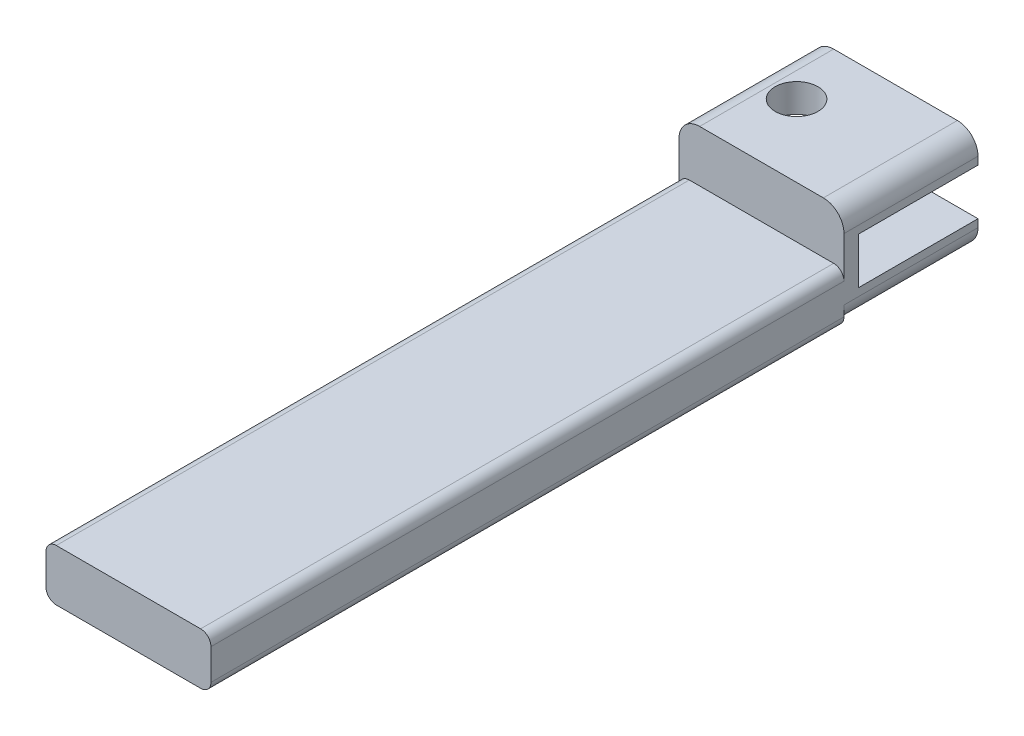
from build123d import *

# Parameters (mm, degrees)
F_01_START                                = 13
F_01_TPU_16_BY_5_GAUGE_DEPTH              = 61.40149944
F_02_CORD_END_BLOCK_DEPTH                 = 13
F_03_START                                = -0.2
S03_OPEN_TWO_EAR_PIN_CLEVIS_W             = 18
S03_OPEN_TWO_EAR_PIN_CLEVIS_H             = 4.5
F_03_OPEN_TWO_EAR_PIN_CLEVIS_DEPTH        = 11.8
F_04_START                                = -5.2
S04_SHOULDER_PIN_THROUGH_BOTH_EARS_R      = 2.08
F_04_SHOULDER_PIN_THROUGH_BOTH_EARS_DEPTH = 10.4


# Read off the part's stored shape, not the designer's step: 01 - TPU 16 by 5 gauge
with BuildPart() as part:
    # 01 - TPU 16 by 5 gauge outline → 01 - TPU 16 by 5 gauge (new body)
    with BuildSketch(Plane.XY.offset(F_01_START)):
        with BuildLine():
            ThreePointArc((-8, -4), (-7.707106781, -4.707106781), (-7, -5))
            Line((-7, -5), (7, -5))
            ThreePointArc((7, -5), (7.707106781, -4.707106781), (8, -4))
            Line((8, -4), (8, -1))
            ThreePointArc((8, -1), (7.707106781, -0.292893219), (7, 0))
            Line((7, 0), (-7, 0))
            ThreePointArc((-7, 0), (-7.707106781, -0.292893219), (-8, -1))
            Line((-8, -1), (-8, -4))
        make_face()
    extrude(amount=F_01_TPU_16_BY_5_GAUGE_DEPTH)

    # S02 - Cord end block → 02 - Cord end block (add)
    with BuildSketch(Plane.XY):
        with BuildLine():
            Line((-6, -5), (6, -5))
            ThreePointArc((6, -5), (7.414213562, -4.414213562), (8, -3))
            Line((8, -3), (8, 3))
            ThreePointArc((8, 3), (7.414213562, 4.414213562), (6, 5))
            Line((6, 5), (-6, 5))
            ThreePointArc((-6, 5), (-7.414213562, 4.414213562), (-8, 3))
            Line((-8, 3), (-8, -3))
            ThreePointArc((-8, -3), (-7.414213562, -4.414213562), (-6, -5))
        make_face()
    extrude(amount=F_02_CORD_END_BLOCK_DEPTH)

    # S03 - Open two-ear pin clevis → 03 - Open two-ear pin clevis (cut)
    with BuildSketch(Plane.XY.offset(F_03_START)):
        Rectangle(S03_OPEN_TWO_EAR_PIN_CLEVIS_W, S03_OPEN_TWO_EAR_PIN_CLEVIS_H)
    extrude(amount=F_03_OPEN_TWO_EAR_PIN_CLEVIS_DEPTH, mode=Mode.SUBTRACT)

    # S04 - Shoulder pin through both ears → 04 - Shoulder pin through both ears (cut)
    with BuildSketch(Plane(origin=(0, 0, 0), x_dir=(1, 0, 0), z_dir=(0, 1, 0)).offset(F_04_START)):
        with Locations(Location((-3.6, -6, 0), (0, 0, 90))):
            Circle(S04_SHOULDER_PIN_THROUGH_BOTH_EARS_R)
    extrude(amount=F_04_SHOULDER_PIN_THROUGH_BOTH_EARS_DEPTH, mode=Mode.SUBTRACT)


solid = part.part
